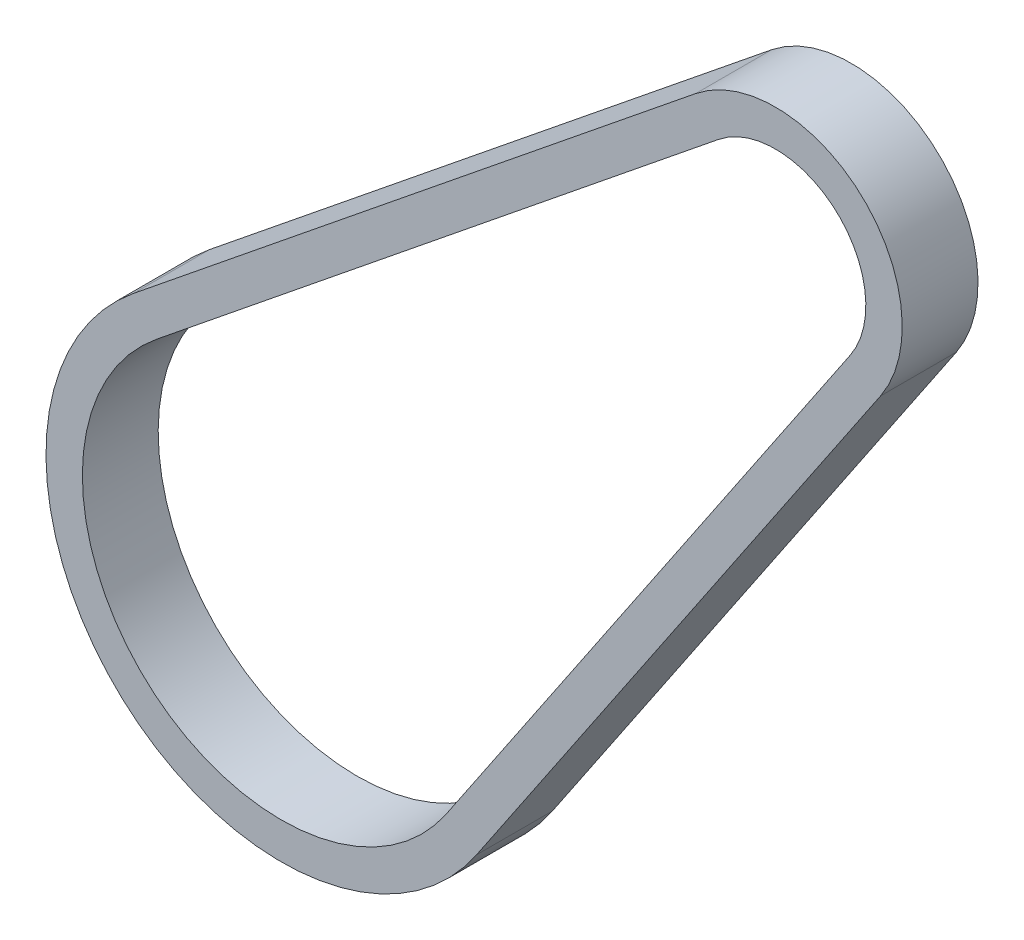
from build123d import *

# Parameters (mm, degrees)
EXTRUDE_THIN1_DEPTH = 5


with BuildPart() as part:
    # Sketch2 → Extrude-Thin1 (new body)
    with BuildSketch(Plane.XY):
        with BuildLine():
            Line((-9.755755133, 12.075516816), (27.334538625, 42.04059651))
            ThreePointArc((27.334538625, 42.04059651), (38.241251646, 41.698912391), (39.523396381, 30.862435019))
            Line((39.523396381, 30.862435019), (12.87277627, -8.676663857))
            ThreePointArc((12.87277627, -8.676663857), (-10.492483303, -11.441182576), (-9.755755133, 12.075516816))
        make_face()
        with BuildLine():
            Line((-8.24751657, 10.208643377), (28.842777188, 40.173723072))
            ThreePointArc((28.842777188, 40.173723072), (36.619114997, 39.930106949), (37.533266727, 32.203846201))
            Line((37.533266727, 32.203846201), (10.882646616, -7.335252674))
            ThreePointArc((10.882646616, -7.335252674), (-8.870346654, -9.672377134), (-8.24751657, 10.208643377))
        make_face(mode=Mode.SUBTRACT)
    extrude(amount=-EXTRUDE_THIN1_DEPTH)


solid = part.part
